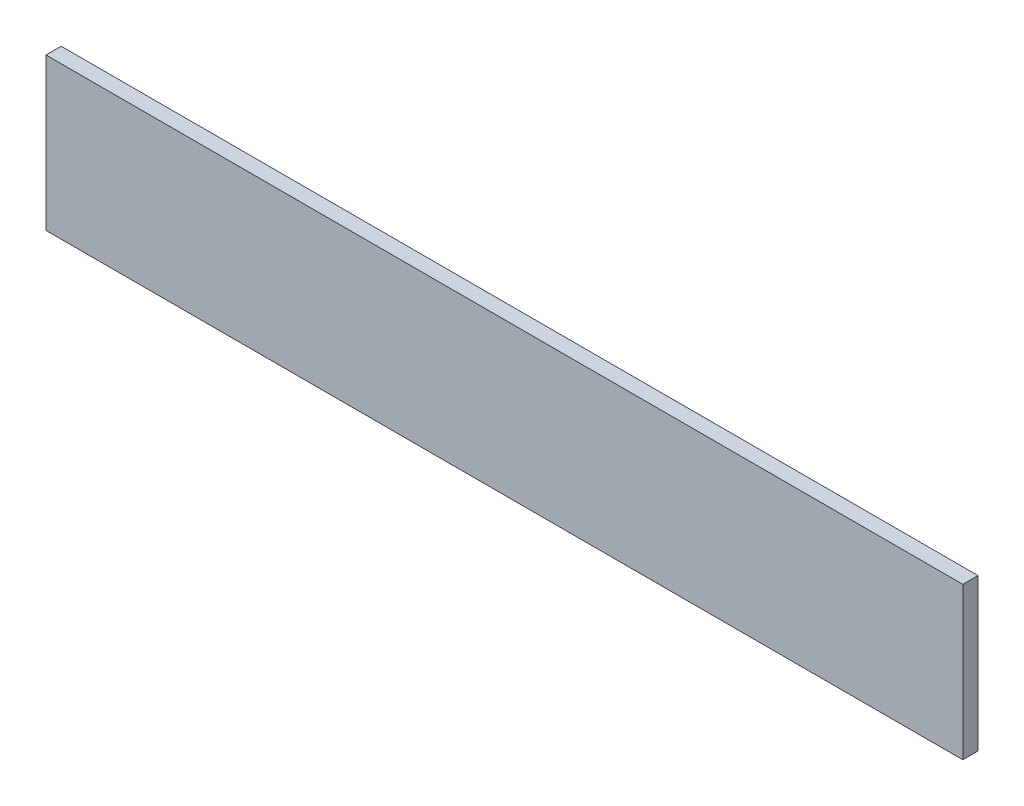
from build123d import *

# Parameters (mm, degrees)
SKETCH1_W           = 181
SKETCH1_H           = 30
BOSS_EXTRUDE1_DEPTH = 3


with BuildPart() as part:
    # Sketch1 → Boss-Extrude1 (new body)
    with BuildSketch(Plane.XY):
        with Locations((90.5, 15)):
            Rectangle(SKETCH1_W, SKETCH1_H)
    extrude(amount=BOSS_EXTRUDE1_DEPTH)


solid = part.part
